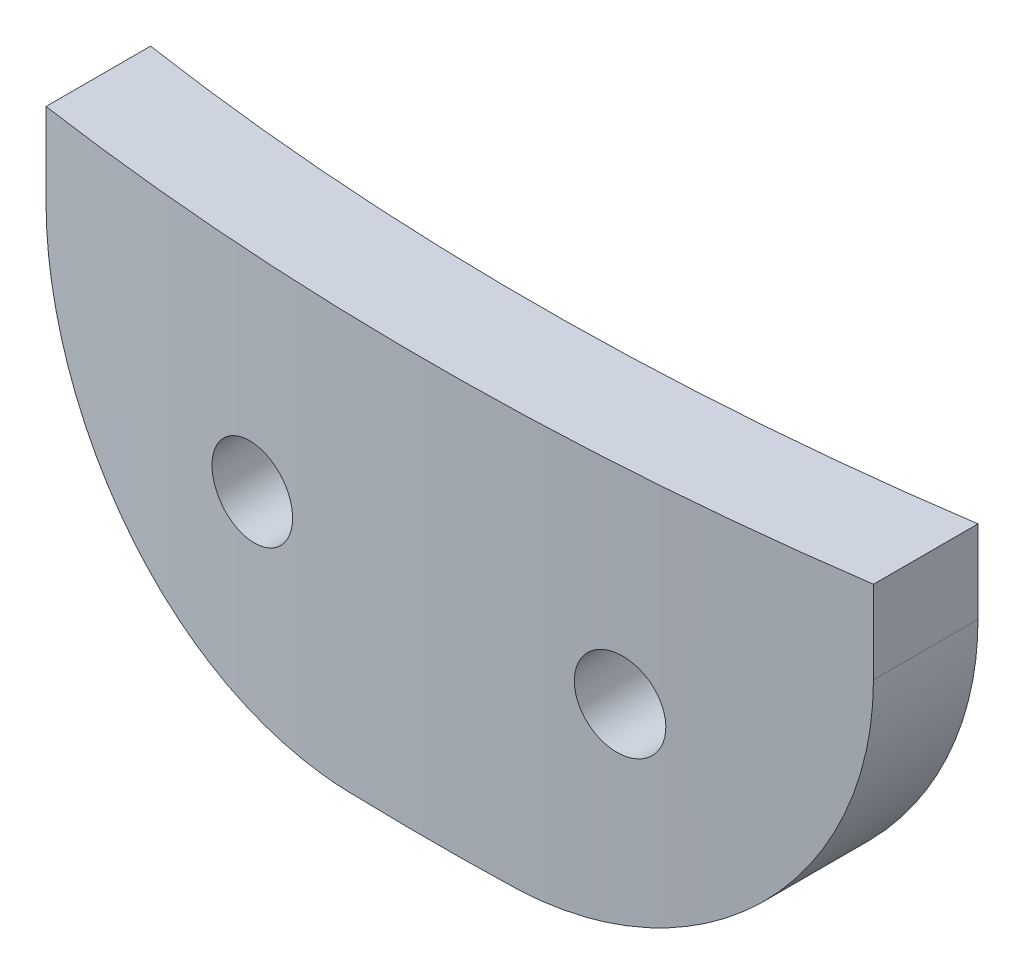
from build123d import *

# Parameters (mm, degrees)
BOSS_EXTRUDE1_DEPTH     = 12.7
CUT_EXTRUDE1_REACH      = 92.696
CUT_EXTRUDE1_END_RADIUS = 88.9
SKETCH2_R               = 1.3208
CUT_EXTRUDE2_REACH      = 92.696
CUT_EXTRUDE2_END_RADIUS = 88.9


with BuildPart() as part:
    # Sketch1 → Boss-Extrude1 (new body)
    with BuildSketch(Plane(origin=(0, 0, 0), x_dir=(1, 0, 0), z_dir=(0, 1, 0))):
        with BuildLine():
            ThreePointArc((12.7, -84.77904001), (0, -85.725), (-12.7, -84.77904001))
            Line((-12.7, -84.77904001), (-12.7, -87.988181024))
            ThreePointArc((-12.7, -87.988181024), (0, -88.9), (12.7, -87.988181024))
            Line((12.7, -87.988181024), (12.7, -84.77904001))
        make_face()
    extrude(amount=BOSS_EXTRUDE1_DEPTH)

    # Cut-Extrude1: up to this cylinder (the profile starts inside it)
    cut_extrude1_end = Plane(origin=(0, 6.35, 0), z_dir=(0, -1, 0)) * Cylinder(CUT_EXTRUDE1_END_RADIUS, 364.192, mode=Mode.PRIVATE)
    # Sketch2 → Cut-Extrude1 (cut, up to the surface)
    with BuildSketch(Plane.XY, mode=Mode.PRIVATE) as cut_extrude1_sk1:
        with Locations((-5.644444444, 6.35)):
            Circle(SKETCH2_R)
    cut_extrude1_tool1 = extrude(cut_extrude1_sk1.sketch, amount=CUT_EXTRUDE1_REACH, mode=Mode.PRIVATE) & cut_extrude1_end
    cut_extrude1 = cut_extrude1_tool1.solids().sort_by_distance((-5.644444, 6.35, 0))[0]
    add(cut_extrude1, mode=Mode.SUBTRACT)

    # Mirror1: Cut-Extrude1 across plane
    add(cut_extrude1.mirror(Plane(origin=(0, 0, 0), x_dir=(0, 0, 1), z_dir=(1, 0, 0))), mode=Mode.SUBTRACT)

    # Cut-Extrude2: up to this cylinder (the profile starts inside it)
    cut_extrude2_end = Plane(origin=(0, 2.269418, 0), z_dir=(0, -1, 0)) * Cylinder(CUT_EXTRUDE2_END_RADIUS, 364.192, mode=Mode.PRIVATE)
    # Sketch3 → Cut-Extrude2 (cut, up to the surface)
    with BuildSketch(Plane.XY, mode=Mode.PRIVATE) as cut_extrude2_sk1:
        with BuildLine():
            ThreePointArc((-2.54, 0), (-9.724204897, 2.975795103), (-12.7, 10.16))
            Line((-12.7, 10.16), (-12.7, 0))
            Line((-12.7, 0), (-2.54, 0))
        make_face()
    cut_extrude2_tool1 = extrude(cut_extrude2_sk1.sketch, amount=CUT_EXTRUDE2_REACH, mode=Mode.PRIVATE) & cut_extrude2_end
    add(cut_extrude2_tool1.solids().sort_by_distance((-10.430582, 2.269418, 0))[0], mode=Mode.SUBTRACT)
    # Sketch3 → Cut-Extrude2 (cut, up to the surface)
    with BuildSketch(Plane.XY, mode=Mode.PRIVATE) as cut_extrude2_sk2:
        with BuildLine():
            Line((12.7, 0), (12.7, 10.16))
            ThreePointArc((12.7, 10.16), (9.724204897, 2.975795103), (2.54, 0))
            Line((2.54, 0), (12.7, 0))
        make_face()
    cut_extrude2_tool2 = extrude(cut_extrude2_sk2.sketch, amount=CUT_EXTRUDE2_REACH, mode=Mode.PRIVATE) & cut_extrude2_end
    add(cut_extrude2_tool2.solids().sort_by_distance((10.430582, 2.269418, 0))[0], mode=Mode.SUBTRACT)


solid = part.part
